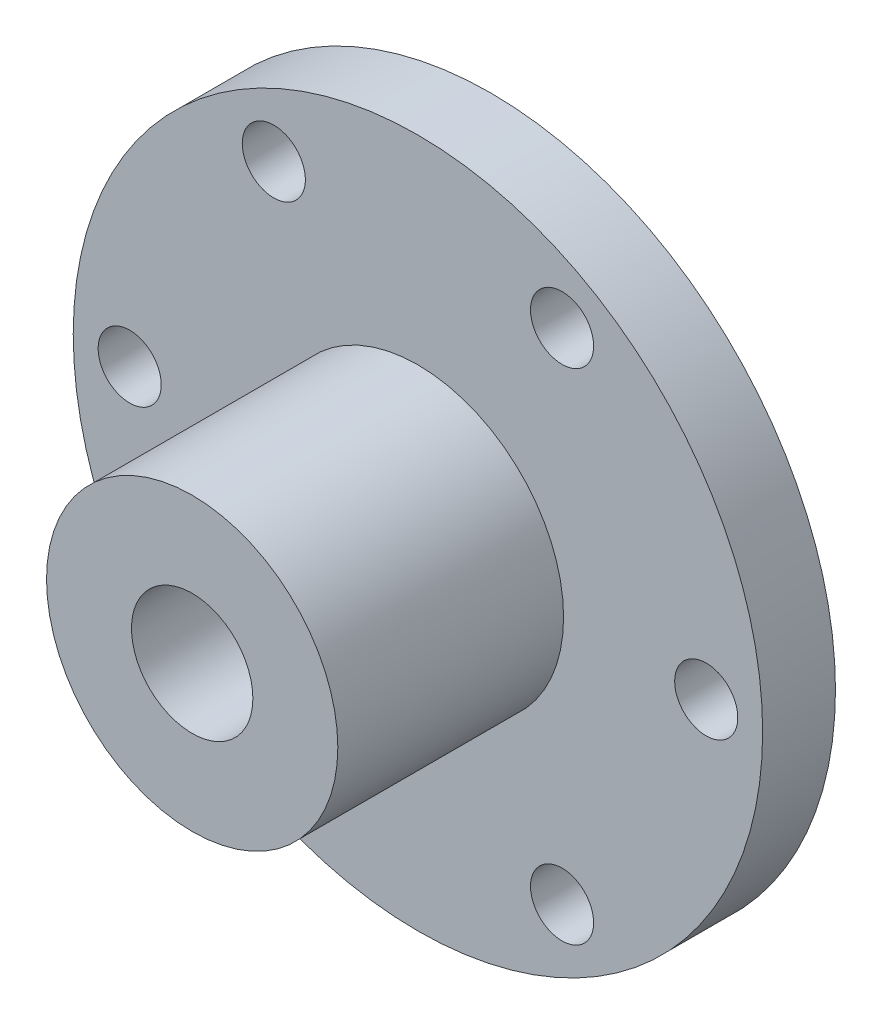
from build123d import *

# Parameters (mm, degrees)
SKETCH2_R          = 2.6
CUT_EXTRUDE1_DEPTH = 48.098619937
CUT_EXTRUDE2_REACH = 49.099
SKETCH3_R          = 2.75


with BuildPart() as part:
    # Sketch1 → Revolve1 (revolve)
    with BuildSketch(Plane(origin=(0, 0, 0), x_dir=(1, 0, 0), z_dir=(0, 1, 0))):
        Polygon((-5, 24.6), (-28.4, 24.6), (-28.4, 18.6), (-12, 18.6), (-12, 0), (-5, 0), align=None)
    revolve(axis=Axis((0, 0, 0), (0, 0, -1)))

    # Sketch2 → Cut-Extrude1 (cut, through all)
    with BuildSketch(Plane(origin=(0, 0, -24.6), x_dir=(-1, 0, 0), z_dir=(0, 0, -1))):
        with Locations((-23.75, 0)):
            Circle(SKETCH2_R)
        with Locations((-11.875, 20.56810334)):
            Circle(SKETCH2_R)
        with Locations((11.875, 20.56810334)):
            Circle(SKETCH2_R)
        with Locations((23.75, 0)):
            Circle(SKETCH2_R)
        with Locations((11.875, -20.56810334)):
            Circle(SKETCH2_R)
        with Locations((-11.875, -20.56810334)):
            Circle(SKETCH2_R)
    extrude(amount=-CUT_EXTRUDE1_DEPTH, mode=Mode.SUBTRACT)

    # Sketch3 → Cut-Extrude2 (cut, up to next)
    with BuildSketch(Plane(origin=(0, 0, 0), x_dir=(1, 0, 0), z_dir=(0, 1, 0)), mode=Mode.PRIVATE) as cut_extrude2_sk1:
        with Locations((0, 10.2)):
            Circle(SKETCH3_R)
    cut_extrude2_tool1 = extrude(cut_extrude2_sk1.sketch, amount=-CUT_EXTRUDE2_REACH, mode=Mode.PRIVATE) & part.part
    add(cut_extrude2_tool1.solids().sort_by_distance((0, 0, -10.2))[0], mode=Mode.SUBTRACT)


solid = part.part
